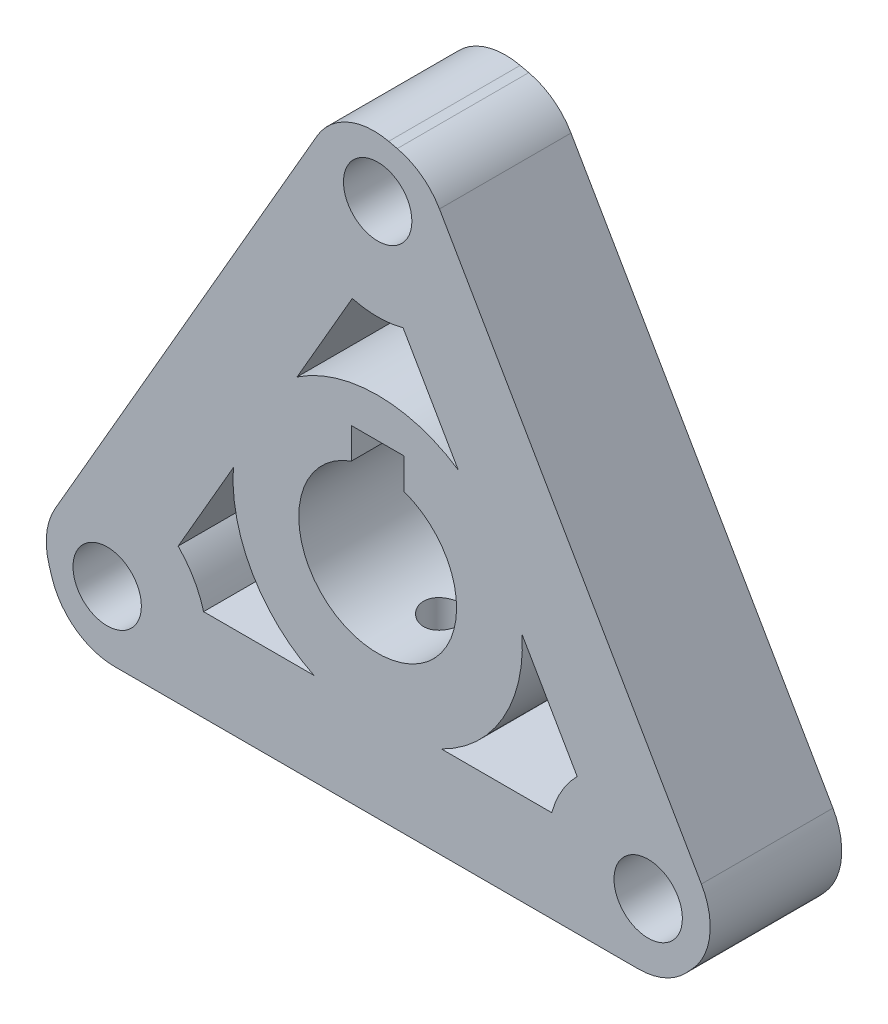
from build123d import *

# Parameters (mm, degrees)
SKETCH_1_R          = 2.6
EXTRUDE_1_DEPTH     = 10
CUT_EXTRUDE_1_REACH = 54.692
SKETCH_3_R          = 1.5
SKETCH_4_R          = 3.1
CUT_EXTRUDE_2_DEPTH = 3
CUT_EXTRUDE_3_DEPTH = 10


with BuildPart() as part:
    # ｽｹｯﾁ1 → ﾎﾞｽ - 押し出し1 (new body)
    with BuildSketch(Plane.XY):
        with BuildLine():
            ThreePointArc((0.836521252, 28.13264673), (-2.279272258, 27.84387272), (-4.613248654, 25.759618943))
            Line((-4.613248654, 25.759618943), (-24.528506183, -8.734618943))
            ThreePointArc((-24.528506183, -8.734618943), (-25.166534704, -10.671209204), (-24.978366464, -12.701493653))
            Line((-24.978366464, -12.701493653), (-24.781847369, -13.34187471))
            ThreePointArc((-24.781847369, -13.34187471), (-22.973864986, -15.895844038), (-20.00186007, -16.875))
            Line((-20.00186007, -16.875), (19.828654989, -16.875))
            ThreePointArc((19.828654989, -16.875), (21.824805612, -16.459253777), (23.488999402, -15.281153076))
            Line((23.488999402, -15.281153076), (23.945326118, -14.790772019))
            ThreePointArc((23.945326118, -14.790772019), (25.253137244, -11.948028682), (24.615108724, -8.884618943))
            Line((24.615108724, -8.884618943), (4.699851194, 25.609618943))
            ThreePointArc((4.699851194, 25.609618943), (3.341729092, 27.130462981), (1.489367062, 27.98264673))
            Line((1.489367062, 27.98264673), (0.836521252, 28.13264673))
        make_face()
        with Locations((-20.56810334, -11.875)):
            Circle(SKETCH_1_R, mode=Mode.SUBTRACT)
        with BuildLine():
            ThreePointArc((6, 0), (-3.464101615, -4.898979486), (-2, 5.656854249))
            Line((-2, 5.656854249), (-2, 8))
            Line((-2, 8), (2, 8))
            Line((2, 8), (2, 5.656854249))
            ThreePointArc((2, 5.656854249), (4.898979486, 3.464101615), (6, 0))
        make_face(mode=Mode.SUBTRACT)
        with Locations((20.56810334, -11.875)):
            Circle(SKETCH_1_R, mode=Mode.SUBTRACT)
        with Locations((0, 23.75)):
            Circle(SKETCH_1_R, mode=Mode.SUBTRACT)
    extrude(amount=EXTRUDE_1_DEPTH)

    # ｽｹｯﾁ3 → ｶｯﾄ - 押し出し1 (cut, up to next)
    with BuildSketch(Plane.XZ.offset(16.875), mode=Mode.PRIVATE) as cut_extrude_1_sk1:
        with Locations((0, 5)):
            Circle(SKETCH_3_R)
    cut_extrude_1_tool1 = extrude(cut_extrude_1_sk1.sketch, amount=-CUT_EXTRUDE_1_REACH, mode=Mode.PRIVATE) & part.part
    add(cut_extrude_1_tool1.solids().sort_by_distance((0, -16.875, 5))[0], mode=Mode.SUBTRACT)

    # ｽｹｯﾁ4 → ｶｯﾄ - 押し出し2 (cut)
    with BuildSketch(Plane.XZ.offset(16.875)):
        with Locations((0, 5)):
            Circle(SKETCH_4_R)
    extrude(amount=-CUT_EXTRUDE_2_DEPTH, mode=Mode.SUBTRACT)

    # ｽｹｯﾁ5 → ｶｯﾄ - 押し出し3 (cut)
    with BuildSketch(Plane(origin=(0, 0, 0), x_dir=(-1, 0, 0), z_dir=(0, 0, -1))):
        with BuildLine():
            ThreePointArc((1.934009748, 16.400196853), (0, 16.15), (-1.934009748, 16.400196853))
            Line((-1.934009748, 16.400196853), (-6.128966865, 9.134317991))
            ThreePointArc((-6.128966865, 9.134317991), (0, 11), (6.128966865, 9.134317991))
            Line((6.128966865, 9.134317991), (1.934009748, 16.400196853))
        make_face()
        with BuildLine():
            ThreePointArc((-4.846067994, -9.875), (-9.526279442, -5.5), (-10.975034859, 0.740682009))
            Line((-10.975034859, 0.740682009), (-15.169991976, -6.525196853))
            ThreePointArc((-15.169991976, -6.525196853), (-13.986310271, -8.075), (-13.235982228, -9.875))
            Line((-13.235982228, -9.875), (-4.846067994, -9.875))
        make_face()
        with BuildLine():
            Line((15.169991976, -6.525196853), (10.975034859, 0.740682009))
            ThreePointArc((10.975034859, 0.740682009), (9.526279442, -5.5), (4.846067994, -9.875))
            Line((4.846067994, -9.875), (13.235982228, -9.875))
            ThreePointArc((13.235982228, -9.875), (13.986310271, -8.075), (15.169991976, -6.525196853))
        make_face()
    extrude(amount=-CUT_EXTRUDE_3_DEPTH, mode=Mode.SUBTRACT)


solid = part.part
